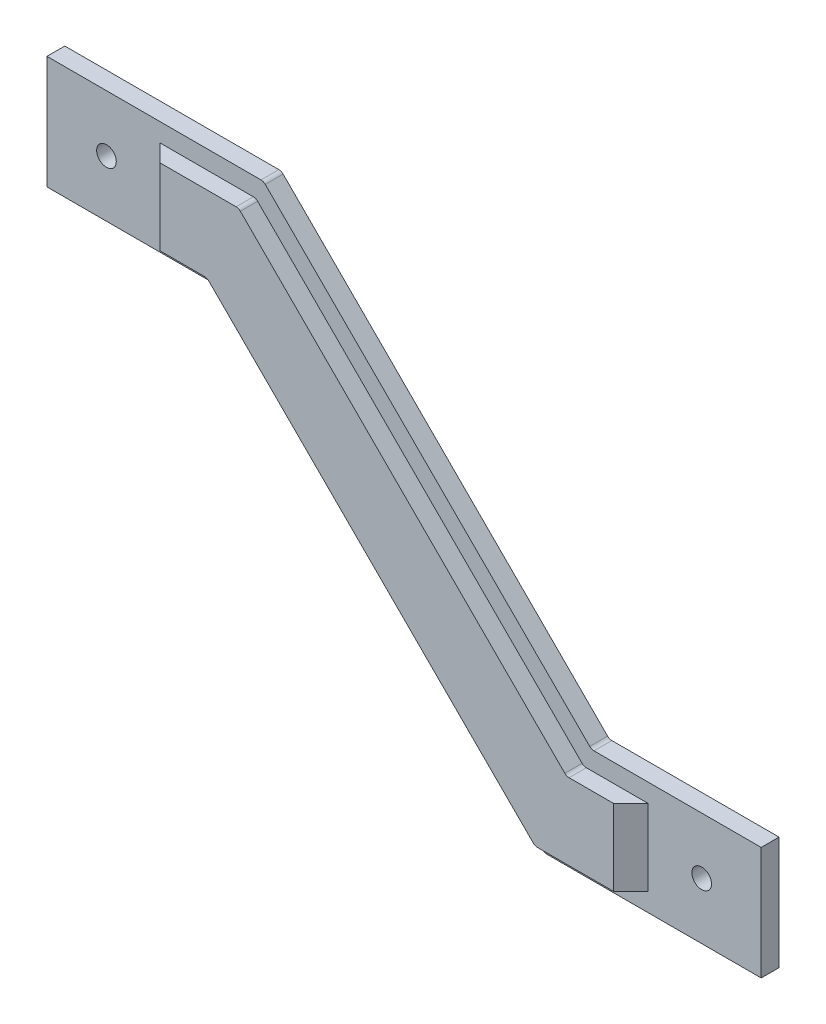
from build123d import *

# Parameters (mm, degrees)
SKETCH_1_R      = 1.65
EXTRUDE_1_DEPTH = 3
EXTRUDE_2_DEPTH = 2.9
CHAMFER_1_SIZE  = 2.9
FILLET_1_R      = 1


with BuildPart() as part:
    # 草图1 → 凸台-拉伸1 (new body)
    with BuildSketch(Plane.XY):
        Polygon((-60, 37.05), (-23.614971157, 37.05), (31.485028843, -18.05), (60, -18.05), (60, -37.05), (23.614971157, -37.05), (-31.485028843, 18.05), (-60, 18.05), align=None)
        with Locations((-50, 27.55)):
            Circle(SKETCH_1_R, mode=Mode.SUBTRACT)
        with Locations((50, -27.55)):
            Circle(SKETCH_1_R, mode=Mode.SUBTRACT)
    extrude(amount=EXTRUDE_1_DEPTH)

    # 草图2 → 凸台-拉伸2 (add)
    with BuildSketch(Plane.XY.offset(3)):
        Polygon((-41, 33.95), (-41, 21.15), (-30.200966799, 21.15), (24.899033201, -33.95), (41, -33.95), (41, -21.15), (30.200966799, -21.15), (-24.899033201, 33.95), align=None)
    extrude(amount=EXTRUDE_2_DEPTH)

    # 倒角1
    chamfer_1_edges = [part.edges().sort_by_distance(p)[0] for p in [
        (41, -27.55, 5.9),
        (-41, 27.55, 5.9),
    ]]
    chamfer(chamfer_1_edges, length=CHAMFER_1_SIZE - 0.0001)  # a hair under: the kernel refuses the full size

    # 圆角1
    fillet_1_edges = [part.edges().sort_by_distance(p)[0] for p in [
        (-23.614971157, 37.05, 1.5),
        (31.485028843, -18.05, 1.5),
        (23.614971157, -37.05, 1.5),
        (-31.485028843, 18.05, 1.5),
        (-24.899033201, 33.95, 4.45),
        (-30.200966799, 21.15, 4.45),
        (24.899033201, -33.95, 4.45),
        (30.200966799, -21.15, 4.45),
    ]]
    fillet(fillet_1_edges, radius=FILLET_1_R)


solid = part.part
